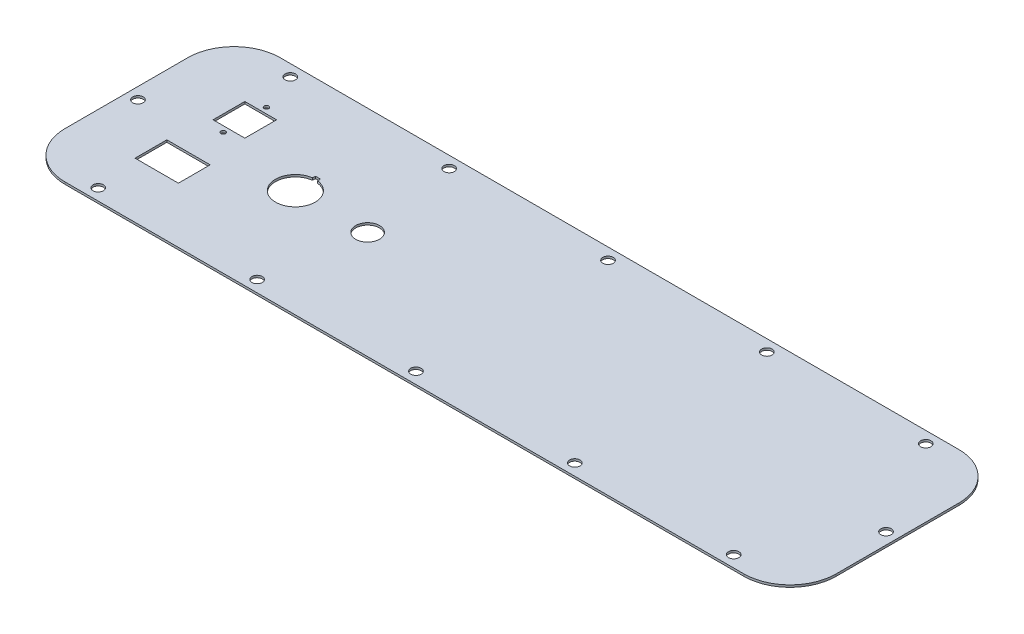
from build123d import *

# Parameters (mm, degrees)
SKETCH1_R           = 3.6
BOSS_EXTRUDE1_DEPTH = 1.5
SKETCH2_R           = 1.6
SKETCH2_R_2         = 8.25
SKETCH2_W           = 22
SKETCH2_H           = 22
SKETCH2_W_2         = 30
CUT_EXTRUDE1_DEPTH  = 278.202994212


with BuildPart() as part:
    # Sketch1 → Boss-Extrude1 (new body)
    with BuildSketch(Plane(origin=(0, 0, 0), x_dir=(1, 0, 0), z_dir=(0, 1, 0))):
        with BuildLine():
            Line((235, -74.5), (-235, -74.5))
            ThreePointArc((-235, -74.5), (-257.627416998, -65.127416998), (-267, -42.5))
            Line((-267, -42.5), (-267, 42.5))
            ThreePointArc((-267, 42.5), (-257.627416998, 65.127416998), (-235, 74.5))
            Line((-235, 74.5), (235, 74.5))
            ThreePointArc((235, 74.5), (257.627416998, 65.127416998), (267, 42.5))
            Line((267, 42.5), (267, -42.5))
            ThreePointArc((267, -42.5), (257.627416998, -65.127416998), (235, -74.5))
        make_face()
        with Locations((-259, 0)):
            Circle(SKETCH1_R, mode=Mode.SUBTRACT)
        with Locations((259, 0)):
            Circle(SKETCH1_R, mode=Mode.SUBTRACT)
        with Locations((-220, 66.5)):
            Circle(SKETCH1_R, mode=Mode.SUBTRACT)
        with Locations((-110, 66.5)):
            Circle(SKETCH1_R, mode=Mode.SUBTRACT)
        with Locations((0, 66.5)):
            Circle(SKETCH1_R, mode=Mode.SUBTRACT)
        with Locations((110, 66.5)):
            Circle(SKETCH1_R, mode=Mode.SUBTRACT)
        with Locations((220, 66.5)):
            Circle(SKETCH1_R, mode=Mode.SUBTRACT)
        with Locations((220, -66.5)):
            Circle(SKETCH1_R, mode=Mode.SUBTRACT)
        with Locations((110, -66.5)):
            Circle(SKETCH1_R, mode=Mode.SUBTRACT)
        with Locations((0, -66.5)):
            Circle(SKETCH1_R, mode=Mode.SUBTRACT)
        with Locations((-110, -66.5)):
            Circle(SKETCH1_R, mode=Mode.SUBTRACT)
        with Locations((-220, -66.5)):
            Circle(SKETCH1_R, mode=Mode.SUBTRACT)
    extrude(amount=BOSS_EXTRUDE1_DEPTH)

    # Sketch2 → Cut-Extrude1 (cut, through all)
    with BuildSketch(Plane(origin=(0, 0, 0), x_dir=(1, 0, 0), z_dir=(0, 1, 0))):
        with Locations((-210, 10)):
            Circle(SKETCH2_R)
        with Locations((-210, 40)):
            Circle(SKETCH2_R)
        with Locations((-100, 0)):
            Circle(SKETCH2_R_2)
        with Locations((-210, 25)):
            Rectangle(SKETCH2_W, SKETCH2_H)
        with BuildLine():
            Line((-151.75, 15.638181697), (-148.25, 15.638181697))
            Line((-148.25, 15.638181697), (-148.25, 13.638181697))
            ThreePointArc((-148.25, 13.638181697), (-150, -13.75), (-151.75, 13.638181697))
            Line((-151.75, 13.638181697), (-151.75, 15.638181697))
        make_face()
        with Locations((-210, -25)):
            Rectangle(SKETCH2_W_2, SKETCH2_H)
    extrude(amount=CUT_EXTRUDE1_DEPTH, mode=Mode.SUBTRACT)


solid = part.part
